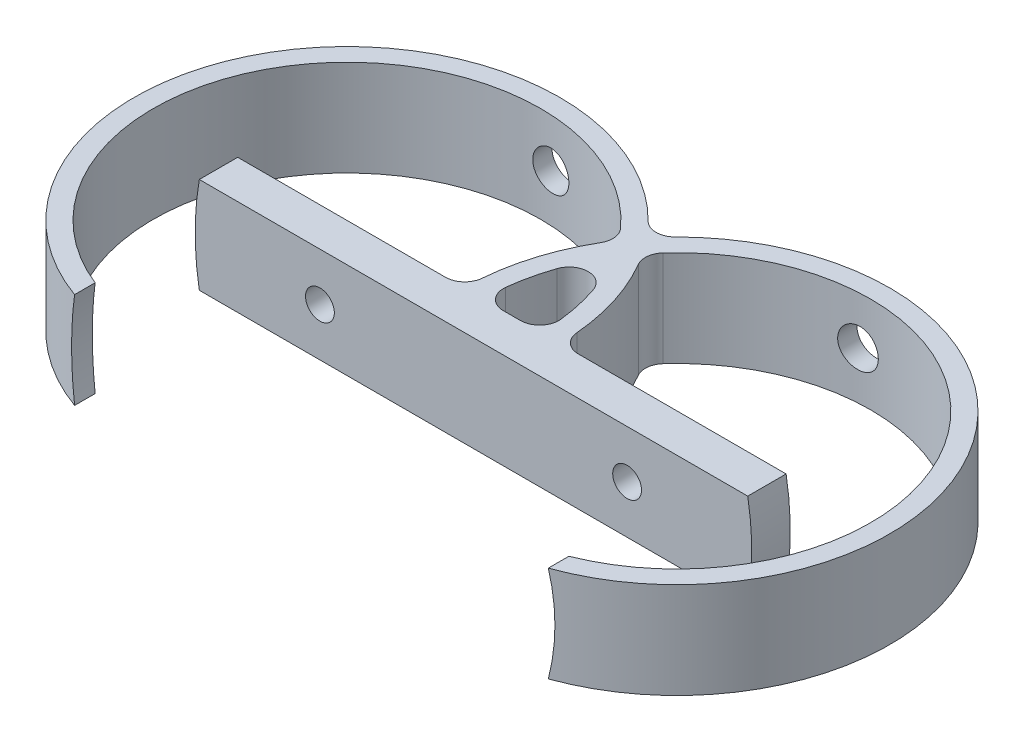
from build123d import *

# Parameters (mm, degrees)
SKETCH2_W               = 58
SKETCH2_H               = 4
BOSS_EXTRUDE1_DEPTH     = 5
CUT_EXTRUDE4_START      = -2
CUT_EXTRUDE4_DEPTH      = 4
CUT_EXTRUDE8_DEPTH      = 30.495762408
CUT_EXTRUDE8_DEPTH_BACK = 30.495762408
SKETCH4_R               = 1.5
BOSS_EXTRUDE2_DEPTH     = 5
SKETCH6_R               = 25.176714318
CUT_EXTRUDE7_DEPTH      = 48.546713727
SKETCH8_R               = 2
CUT_EXTRUDE9_DEPTH      = 46.466564837
FILLET1_R               = 2


# Read off the part's stored shape, not the designer's step: Cut-Extrude4
with BuildPart() as part:
    # Sketch2 → Boss-Extrude1 (new, symmetric)
    with BuildSketch(Plane(origin=(0, 0, 0), x_dir=(1, 0, 0), z_dir=(0, 1, 0))):
        Rectangle(SKETCH2_W, SKETCH2_H)
    extrude(amount=BOSS_EXTRUDE1_DEPTH, both=True)

    # Cut-Extrude4 outline → Cut-Extrude4 (cut)
    with BuildSketch(Plane.XY.offset(CUT_EXTRUDE4_START)):
        with BuildLine():
            ThreePointArc((-29, 2.66e-07), (-28.891224415, 2.509412642), (-28.565713714, 5))
            Line((-28.565713714, 5), (-29, 5))
            Line((-29, 5), (-29, 2.66e-07))
        make_face()
        with BuildLine():
            ThreePointArc((-28.565713714, -5), (-28.891224438, -2.509412377), (-29, 2.66e-07))
            Line((-29, 2.66e-07), (-29, -5))
            Line((-29, -5), (-28.565713714, -5))
        make_face()
        with BuildLine():
            Line((29, 5), (28.565713714, 5))
            ThreePointArc((28.565713714, 5), (28.891224438, 2.509412377), (29, -2.66e-07))
            Line((29, -2.66e-07), (29, 5))
        make_face()
        with BuildLine():
            Line((29, -5), (29, -2.66e-07))
            ThreePointArc((29, -2.66e-07), (28.891224415, -2.509412642), (28.565713714, -5))
            Line((28.565713714, -5), (29, -5))
        make_face()
    extrude(amount=CUT_EXTRUDE4_DEPTH, mode=Mode.SUBTRACT)

    # Sketch4 → Cut-Extrude8 (cut, two sides: drawn at the far end of the back side and taken through both)
    with BuildSketch(Plane.XY.offset(-CUT_EXTRUDE8_DEPTH_BACK)):
        with Locations((16, 0)):
            Circle(SKETCH4_R)
        with Locations((-16, 0)):
            Circle(SKETCH4_R)
    extrude(amount=CUT_EXTRUDE8_DEPTH + CUT_EXTRUDE8_DEPTH_BACK, mode=Mode.SUBTRACT)

    # Sketch5 → Boss-Extrude2 (add, symmetric)
    with BuildSketch(Plane(origin=(0, 0, 0), x_dir=(1, 0, 0), z_dir=(0, 1, 0))):
        with BuildLine():
            Line((-24, -17), (-24.675229358, -18.882568807))
            ThreePointArc((-24.675229358, -18.882568807), (-29.952612974, 20.143186858), (5, 2))
            Line((5, 2), (3, 2))
            ThreePointArc((3, 2), (-28.801626162, 18.507574019), (-24, -17))
        make_face()
        with BuildLine():
            Line((-3, 2), (-5, 2))
            ThreePointArc((-5, 2), (29.952612974, 20.143186858), (24.675229358, -18.882568807))
            Line((24.675229358, -18.882568807), (24, -17))
            ThreePointArc((24, -17), (28.801626162, 18.507574019), (-3, 2))
        make_face()
    extrude(amount=BOSS_EXTRUDE2_DEPTH, both=True)

    # Sketch6 → Cut-Extrude7 (cut, through all)
    with BuildSketch(Plane.XY.offset(2)):
        Circle(SKETCH6_R)
    extrude(amount=CUT_EXTRUDE7_DEPTH, mode=Mode.SUBTRACT)

    # Sketch8 → Cut-Extrude9 (cut, through all)
    with BuildSketch(Plane(origin=(0, 0, -2), x_dir=(-1, 0, 0), z_dir=(0, 0, -1))):
        with Locations(Location((16, 0, 0), (0, 0, 180))):
            Circle(SKETCH8_R)
        with Locations(Location((-16, 0, 0), (0, 0, 180))):
            Circle(SKETCH8_R)
    extrude(amount=CUT_EXTRUDE9_DEPTH, mode=Mode.SUBTRACT)

    # Fillet1
    fillet1_edges = [part.edges().sort_by_distance(p)[0] for p in [
        (0, 0, -16.030390296),
        (0, 0, -12.58825345),
        (3, 0, -2),
        (5, 0, -2),
        (-5, 0, -2),
        (-3, 0, -2),
        (-1.232758621, 0, -14.367772138),
        (1.232758621, 0, -14.367772138),
    ]]
    fillet(fillet1_edges, radius=FILLET1_R)


solid = part.part
